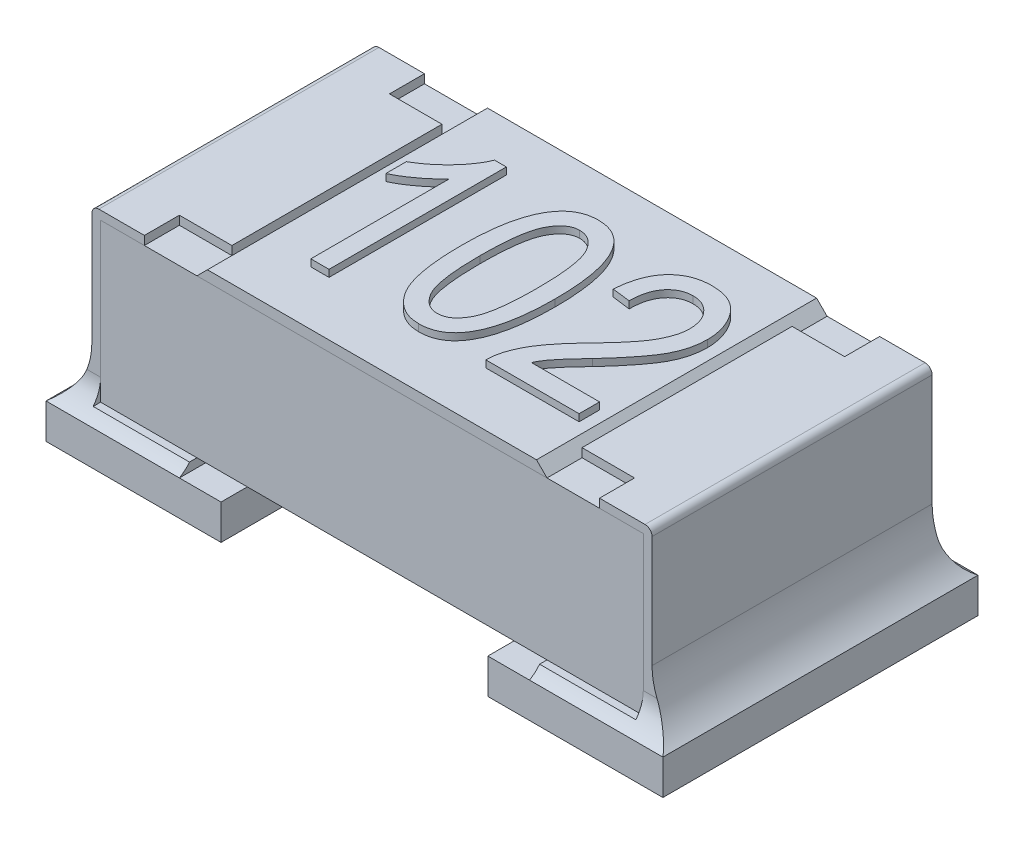
from build123d import *

# Parameters (mm, degrees)
SKETCH1_W             = 0.8
SKETCH1_H             = 0.45
BOSS_EXTRUDE1_DEPTH   = 0.775
BOSS_EXTRUDE2_DEPTH   = 0.4
BOSS_EXTRUDE2_2_DEPTH = 0.4
SKETCH3_W             = 0.15
SKETCH3_H             = 0.1
CUT_EXTRUDE1_DEPTH    = 0.025
BOSS_EXTRUDE3_DEPTH   = 0.4
SKETCH7_W             = 0.5
SKETCH7_H             = 0.9
BOSS_EXTRUDE5_DEPTH   = 0.1
FILLET3_R             = 0.2
FILLET4_R             = 0.2
FILLET5_R             = 0.1
FILLET6_R             = 0.1
BOSS_EXTRU_1_DEPTH    = 0.02


with BuildPart() as part:
    # Sketch1 → Boss-Extrude1 (new, symmetric)
    with BuildSketch(Plane(origin=(0, 0, 0), x_dir=(0, 0, -1), z_dir=(1, 0, 0))):
        with Locations((0, 0.35)):
            Rectangle(SKETCH1_W, SKETCH1_H)
    extrude(amount=BOSS_EXTRUDE1_DEPTH, both=True)


with BuildPart() as body_2:
    # Sketch2 → Boss-Extrude2 (new, symmetric)
    with BuildSketch(Plane.XY):
        with BuildLine():
            Line((-0.5, 0.6), (-0.78, 0.6))
            ThreePointArc((-0.78, 0.6), (-0.794142136, 0.594142136), (-0.8, 0.58))
            Line((-0.8, 0.58), (-0.8, 0.1))
            Line((-0.8, 0.1), (-0.5, 0.1))
            Line((-0.5, 0.1), (-0.5, 0.125))
            Line((-0.5, 0.125), (-0.775, 0.125))
            Line((-0.775, 0.125), (-0.775, 0.575))
            Line((-0.775, 0.575), (-0.5, 0.575))
            Line((-0.5, 0.575), (-0.5, 0.6))
        make_face()
    extrude(amount=BOSS_EXTRUDE2_DEPTH, both=True)


with BuildPart() as body_3:
    # Sketch2 → Boss-Extrude2 2 (new, symmetric)
    with BuildSketch(Plane.XY):
        with BuildLine():
            Line((0.5, 0.575), (0.5, 0.6))
            Line((0.5, 0.6), (0.78, 0.6))
            ThreePointArc((0.78, 0.6), (0.794142136, 0.594142136), (0.8, 0.58))
            Line((0.8, 0.58), (0.8, 0.1))
            Line((0.8, 0.1), (0.5, 0.1))
            Line((0.5, 0.1), (0.5, 0.125))
            Line((0.5, 0.125), (0.775, 0.125))
            Line((0.775, 0.125), (0.775, 0.575))
            Line((0.775, 0.575), (0.5, 0.575))
        make_face()
    extrude(amount=BOSS_EXTRUDE2_2_DEPTH, both=True)


with BuildPart() as cut_extrude1_tool:
    # Sketch3 → Cut-Extrude1 (new body)
    with BuildSketch(Plane(origin=(0, 0.6, 0), x_dir=(1, 0, 0), z_dir=(0, 1, 0))):
        with Locations((-0.575, 0.35)):
            Rectangle(SKETCH3_W, SKETCH3_H)
        with Locations((-0.575, -0.35)):
            Rectangle(SKETCH3_W, SKETCH3_H)
        with Locations((0.575, -0.35)):
            Rectangle(SKETCH3_W, SKETCH3_H)
        with Locations((0.575, 0.35)):
            Rectangle(SKETCH3_W, SKETCH3_H)
    extrude(amount=-CUT_EXTRUDE1_DEPTH)


with BuildPart() as body_2_1:
    add(body_2.part)

    # Cut-Extrude1: cut by cut_extrude1_tool
    add(cut_extrude1_tool.part, mode=Mode.SUBTRACT)



with BuildPart() as body_3_1:
    add(body_3.part)

    # Cut-Extrude1: cut by cut_extrude1_tool
    add(cut_extrude1_tool.part, mode=Mode.SUBTRACT)


with BuildPart() as body_4:
    # Sketch4 → Boss-Extrude3 (new, symmetric)
    with BuildSketch(Plane.XY):
        Polygon((-0.5, 0.575), (0.5, 0.575), (0.47, 0.605), (-0.47, 0.605), align=None)
    extrude(amount=BOSS_EXTRUDE3_DEPTH, both=True)

    # Esquisse2 → Boss.-Extru.1 (add)
    # profile 1 of 3: a face of its own
    with BuildSketch(Plane(origin=(0, 0.605, 0), x_dir=(1, 0, 0), z_dir=(0, 1, 0))):
        with BuildLine():
            Line((-0.277419159, -0.245221888), (-0.329367211, -0.245221888))
            Line((-0.329367211, -0.245221888), (-0.329367211, 0.150882009))
            add(Edge.make_bspline(
                [(-0.329367211, 0.150882009), (-0.33255753, 0.147209677), (-0.339169464, 0.139598774), (-0.350647442, 0.128775009), (-0.363438381, 0.1176135), (-0.377599648, 0.106782892), (-0.392028853, 0.096408923), (-0.406280373, 0.087284837), (-0.41982007, 0.079346193), (-0.428903295, 0.075031174), (-0.433263315, 0.072959931)],
                knots=[0, 0, 0, 0, 0.892555828, 1.849821039, 2.893015883, 4.008277588, 5.121255548, 6.154629642, 7.114207698, 8, 8, 8, 8], degree=3))
            Line((-0.433263315, 0.072959931), (-0.433263315, 0.131401489))
            add(Edge.make_bspline(
                [(-0.433263315, 0.131401489), (-0.426256411, 0.13561851), (-0.412302603, 0.144016443), (-0.392751491, 0.158564375), (-0.374281809, 0.174266475), (-0.35744561, 0.191287267), (-0.342370643, 0.208833156), (-0.329431452, 0.226343975), (-0.318822135, 0.243633673), (-0.313617925, 0.255526991), (-0.311104224, 0.261271619)],
                knots=[0, 0, 0, 0, 1.082272232, 2.155277244, 3.222407096, 4.289527553, 5.32168536, 6.282742408, 7.170542132, 8, 8, 8, 8], degree=3))
            Line((-0.311104224, 0.261271619), (-0.277419159, 0.261271619))
            Line((-0.277419159, 0.261271619), (-0.277419159, -0.245221888))
        make_face()
    # profile 2 of 3: a face of its own
    with BuildSketch(Plane(origin=(0, 0.605, 0), x_dir=(1, 0, 0), z_dir=(0, 1, 0))):
        with BuildLine():
            add(Edge.make_bspline(
                [(-0.147549029, 0.00457519), (-0.147466537, 0.01479126), (-0.147306358, 0.034628409), (-0.145650941, 0.063399949), (-0.143039858, 0.090278959), (-0.139489137, 0.115229398), (-0.134683655, 0.138255011), (-0.12902472, 0.15939274), (-0.122074419, 0.178575365), (-0.114251427, 0.195885139), (-0.105280253, 0.21122541), (-0.095389914, 0.224648892), (-0.084287025, 0.235937722), (-0.072277736, 0.245324824), (-0.059123137, 0.252476152), (-0.04501046, 0.257615666), (-0.029887534, 0.260717058), (-0.019452187, 0.261084261), (-0.014127763, 0.261271619)],
                knots=[0, 0, 0, 0, 1.522295809, 2.955932353, 4.292935845, 5.545987552, 6.709403679, 7.796379217, 8.803980711, 9.746667296, 10.623167879, 11.447716403, 12.224665142, 12.975696349, 13.710987297, 14.4460191, 15.207112772, 16, 16, 16, 16], degree=3))
            add(Edge.make_bspline(
                [(-0.014127763, 0.261271619), (-0.00938285, 0.261119405), (-6.4928e-05, 0.260820492), (0.013532278, 0.258355488), (0.026321328, 0.254161939), (0.038311883, 0.248334155), (0.04946752, 0.240809961), (0.059897997, 0.231712272), (0.069489012, 0.22085766), (0.075042737, 0.212703293), (0.0778974, 0.208511879)],
                knots=[0, 0, 0, 0, 1.02435884, 2.0116063, 2.972586715, 3.92329494, 4.881606269, 5.870473939, 6.905405214, 8, 8, 8, 8], degree=3))
            add(Edge.make_bspline(
                [(0.0778974, 0.208511879), (0.081201753, 0.202860902), (0.088073505, 0.191109101), (0.09627871, 0.171419216), (0.103194942, 0.149427268), (0.109026426, 0.125063264), (0.113186158, 0.098276968), (0.116478331, 0.069172575), (0.118383679, 0.037676929), (0.118581978, 0.015873733), (0.118684737, 0.00457519)],
                knots=[0, 0, 0, 0, 0.745747152, 1.550859881, 2.42529298, 3.372802996, 4.404287875, 5.514077945, 6.711780846, 8, 8, 8, 8], degree=3))
            add(Edge.make_bspline(
                [(0.118684737, 0.00457519), (0.118603246, -0.005573368), (0.118445039, -0.025275587), (0.116773055, -0.053910105), (0.114196761, -0.080658499), (0.110597814, -0.10553284), (0.105836898, -0.128501924), (0.100102772, -0.149633905), (0.093369381, -0.168919426), (0.085438101, -0.186231046), (0.076598991, -0.201660817), (0.066540873, -0.214948272), (0.055705564, -0.226438872), (0.043540388, -0.23562265), (0.030475546, -0.242976397), (0.016267757, -0.248029288), (0.001094421, -0.251174149), (-0.009377101, -0.25153216), (-0.014736529, -0.251715394)],
                knots=[0, 0, 0, 0, 1.513874866, 2.939007974, 4.277477108, 5.521918538, 6.686610019, 7.774777114, 8.786532326, 9.730252297, 10.61206932, 11.433487149, 12.211385775, 12.960169701, 13.698700869, 14.439280195, 15.201208188, 16, 16, 16, 16], degree=3))
            add(Edge.make_bspline(
                [(-0.014736529, -0.251715394), (-0.019516724, -0.251535975), (-0.028915126, -0.251183218), (-0.042705055, -0.248501144), (-0.05575647, -0.243876751), (-0.068138313, -0.237523555), (-0.079867046, -0.229401051), (-0.090799365, -0.219338145), (-0.101199397, -0.207599728), (-0.110942062, -0.19396939), (-0.119746041, -0.178096762), (-0.127188231, -0.159604049), (-0.133528749, -0.138579583), (-0.138560256, -0.114938484), (-0.142795274, -0.08877738), (-0.145456819, -0.059965056), (-0.147220924, -0.028557109), (-0.147436804, -0.006757381), (-0.147549029, 0.00457519)],
                knots=[0, 0, 0, 0, 0.713782411, 1.403376538, 2.088831486, 2.775699897, 3.476400496, 4.213162367, 4.989742879, 5.815463779, 6.710980744, 7.6941898, 8.787315853, 9.987366569, 11.302150399, 12.743876293, 14.307306722, 16, 16, 16, 16], degree=3))
        make_face()
        with BuildLine():
            add(Edge.make_bspline(
                [(-0.095600977, 0.004778112), (-0.095510395, -0.004962844), (-0.095337358, -0.023570963), (-0.094386416, -0.050273881), (-0.092589043, -0.074440086), (-0.090092676, -0.096145725), (-0.086927693, -0.115301137), (-0.083021376, -0.132011786), (-0.078366616, -0.146209724), (-0.072890289, -0.158097103), (-0.066817423, -0.167965156), (-0.060330818, -0.176373903), (-0.053623871, -0.183666527), (-0.046292266, -0.189491854), (-0.038680682, -0.194202042), (-0.030494994, -0.19727545), (-0.022023943, -0.199493814), (-0.016171753, -0.199675523), (-0.013214613, -0.199767342)],
                knots=[0, 0, 0, 0, 1.930873368, 3.688541263, 5.295281011, 6.732986767, 8.018032389, 9.141589856, 10.131594649, 10.974379403, 11.729767228, 12.422984227, 13.077418253, 13.687793181, 14.274134012, 14.843047171, 15.415386244, 16, 16, 16, 16], degree=3))
            add(Edge.make_bspline(
                [(-0.013214613, -0.199767342), (-0.010427064, -0.19967107), (-0.004876608, -0.199479377), (0.003214206, -0.197283662), (0.011014124, -0.194062792), (0.018392056, -0.189401372), (0.025337409, -0.183405877), (0.031944313, -0.176126804), (0.038222607, -0.167556151), (0.044243115, -0.157540122), (0.049661257, -0.145592351), (0.054269802, -0.131326946), (0.058147641, -0.114621658), (0.061355308, -0.095476215), (0.063679163, -0.073856395), (0.065539644, -0.049836144), (0.066465897, -0.023333722), (0.066643834, -0.004861208), (0.066736685, 0.004778112)],
                knots=[0, 0, 0, 0, 0.556098029, 1.107279675, 1.665020537, 2.239289732, 2.843790749, 3.494855459, 4.20099618, 4.965402842, 5.827994078, 6.818278647, 7.958442113, 9.254955883, 10.697998423, 12.305588537, 14.072183745, 16, 16, 16, 16], degree=3))
            add(Edge.make_bspline(
                [(0.066736685, 0.004778112), (0.066644247, 0.014518953), (0.066467022, 0.033194439), (0.065536544, 0.059932684), (0.063706558, 0.084163121), (0.061254358, 0.105841815), (0.058028708, 0.125018143), (0.054199757, 0.141717126), (0.049468888, 0.155886496), (0.044070333, 0.167750164), (0.037873861, 0.177530431), (0.031547138, 0.186066808), (0.024613966, 0.193179002), (0.017326453, 0.199101273), (0.009578464, 0.203716122), (0.001336, 0.207013805), (-0.007336855, 0.208998194), (-0.013272092, 0.209214654), (-0.016258444, 0.209323567)],
                knots=[0, 0, 0, 0, 1.926173374, 3.692928135, 5.28908838, 6.72993665, 8.005261178, 9.132588719, 10.113846285, 10.954579593, 11.702439438, 12.399284011, 13.051919516, 13.660808713, 14.251466784, 14.827675714, 15.41013748, 16, 16, 16, 16], degree=3))
            add(Edge.make_bspline(
                [(-0.016258444, 0.209323567), (-0.019046448, 0.209229838), (-0.024564948, 0.209044314), (-0.032588492, 0.206839344), (-0.040285896, 0.203615308), (-0.047609781, 0.198933153), (-0.054467733, 0.192853165), (-0.061128216, 0.185619176), (-0.067268818, 0.176971227), (-0.073311403, 0.16704689), (-0.078634531, 0.155067165), (-0.083250225, 0.140826575), (-0.086962575, 0.124091318), (-0.090243034, 0.105003485), (-0.092537193, 0.083411294), (-0.094405868, 0.059392779), (-0.095329633, 0.03288983), (-0.095507935, 0.014417392), (-0.095600977, 0.004778112)],
                knots=[0, 0, 0, 0, 0.557102101, 1.102712893, 1.655222221, 2.224793741, 2.834805151, 3.487045402, 4.190458401, 4.956245252, 5.811421647, 6.809929224, 7.950602775, 9.242777249, 10.688425301, 12.298918027, 14.068702942, 16, 16, 16, 16], degree=3))
        make_face(mode=Mode.SUBTRACT)
    # profile 3 of 3: a face of its own
    with BuildSketch(Plane(origin=(0, 0.605, 0), x_dir=(1, 0, 0), z_dir=(0, 1, 0))):
        with BuildLine():
            Line((0.436866556, -0.186780329), (0.436866556, -0.245221888))
            Line((0.436866556, -0.245221888), (0.170632789, -0.245221888))
            add(Edge.make_bspline(
                [(0.170632789, -0.245221888), (0.170620463, -0.242176838), (0.170595488, -0.236007517), (0.171425805, -0.226601844), (0.173131761, -0.216968453), (0.175310093, -0.206978835), (0.17839873, -0.196764374), (0.182179794, -0.186275439), (0.186641118, -0.175538143), (0.191864922, -0.164488895), (0.197969199, -0.153021711), (0.205335292, -0.141184566), (0.213800759, -0.128765128), (0.223376797, -0.115839112), (0.234250689, -0.102529104), (0.246099687, -0.088637518), (0.259092893, -0.074193289), (0.268344083, -0.064593521), (0.273108439, -0.059649647)],
                knots=[0, 0, 0, 0, 0.672188691, 1.361865275, 2.08134618, 2.831455259, 3.618325166, 4.435686407, 5.292818481, 6.184803937, 7.133719261, 8.159707436, 9.261705982, 10.452168352, 11.710682541, 13.056179633, 14.483934645, 16, 16, 16, 16], degree=3))
            add(Edge.make_bspline(
                [(0.273108439, -0.059649647), (0.278645154, -0.053922862), (0.28930567, -0.042896383), (0.304309328, -0.026615111), (0.317941658, -0.011481871), (0.329930295, 0.002776991), (0.340488081, 0.015967273), (0.349721239, 0.028070116), (0.357188517, 0.039360185), (0.365251054, 0.052644574), (0.372937537, 0.068459429), (0.379732824, 0.086894144), (0.384123449, 0.104715028), (0.384658645, 0.116463957), (0.384918504, 0.122168535)],
                knots=[0, 0, 0, 0, 1.312560889, 2.527233899, 3.64818266, 4.668586789, 5.596397896, 6.432357998, 7.175835261, 7.825761013, 8.992224112, 10.065918602, 11.060925749, 12, 12, 12, 12], degree=3))
            add(Edge.make_bspline(
                [(0.384918504, 0.122168535), (0.38488227, 0.125317915), (0.384811501, 0.131468985), (0.383608892, 0.140451965), (0.381893813, 0.14899617), (0.3796294, 0.157163351), (0.376418723, 0.164819361), (0.372571791, 0.172017316), (0.368065657, 0.178789817), (0.362923472, 0.185037408), (0.357252813, 0.190673516), (0.351276734, 0.195736851), (0.344839772, 0.199834879), (0.338206488, 0.203402296), (0.33115273, 0.205987741), (0.323827032, 0.207958519), (0.316161618, 0.209069733), (0.310956748, 0.209238117), (0.308315419, 0.209323567)],
                knots=[0, 0, 0, 0, 1.164486654, 2.274364258, 3.346924328, 4.388668322, 5.404300818, 6.412115579, 7.404820287, 8.409522099, 9.400647826, 10.360464378, 11.301161788, 12.219192522, 13.141987859, 14.073903283, 15.022558797, 16, 16, 16, 16], degree=3))
            add(Edge.make_bspline(
                [(0.308315419, 0.209323567), (0.305467549, 0.209263822), (0.299908376, 0.209147197), (0.291805518, 0.207697867), (0.284041492, 0.205758951), (0.276655696, 0.202751859), (0.269702154, 0.198899959), (0.263080695, 0.194263463), (0.256920928, 0.188754733), (0.251098767, 0.182490648), (0.245994902, 0.175347606), (0.241308805, 0.167618053), (0.237618701, 0.158974566), (0.234481048, 0.149683668), (0.232023772, 0.139637057), (0.230381279, 0.128872622), (0.229176758, 0.117392989), (0.229109112, 0.109489326), (0.229074348, 0.105427463)],
                knots=[0, 0, 0, 0, 0.928788257, 1.813037313, 2.680996359, 3.53827917, 4.408273621, 5.272359245, 6.172129225, 7.102295458, 8.058839945, 9.034325244, 10.048074492, 11.120300332, 12.234644845, 13.420320921, 14.674247329, 16, 16, 16, 16], degree=3))
            Line((0.229074348, 0.105427463), (0.177126296, 0.11192097))
            add(Edge.make_bspline(
                [(0.177126296, 0.11192097), (0.177661646, 0.117949128), (0.178700249, 0.129644029), (0.181425255, 0.146574214), (0.185206691, 0.162282392), (0.189695492, 0.176925272), (0.195342921, 0.190321129), (0.201656925, 0.202713751), (0.209140532, 0.213833745), (0.217485989, 0.223818585), (0.226623406, 0.232677174), (0.236501282, 0.24032371), (0.247106206, 0.246769595), (0.258317066, 0.252189545), (0.270365598, 0.256236922), (0.283035651, 0.259174418), (0.296430274, 0.260914731), (0.305570867, 0.261150899), (0.310243179, 0.261271619)],
                knots=[0, 0, 0, 0, 1.296155121, 2.514599762, 3.669097984, 4.755193195, 5.79120272, 6.77953026, 7.729955905, 8.65570694, 9.562583864, 10.450894749, 11.325630111, 12.216772649, 13.112585423, 14.04224033, 14.999270054, 16, 16, 16, 16], degree=3))
            add(Edge.make_bspline(
                [(0.310243179, 0.261271619), (0.315287924, 0.261123536), (0.325110881, 0.260835194), (0.339410791, 0.258935248), (0.352748071, 0.255583871), (0.365182294, 0.250920378), (0.376564128, 0.244781019), (0.387078711, 0.237416689), (0.396550564, 0.228603521), (0.404979649, 0.21857538), (0.412428841, 0.207748797), (0.418928747, 0.196427916), (0.424566895, 0.18480032), (0.428973266, 0.172736626), (0.432653055, 0.16039874), (0.434964779, 0.147599635), (0.436592216, 0.134486989), (0.436774592, 0.125623379), (0.436866556, 0.121153924)],
                knots=[0, 0, 0, 0, 1.141256367, 2.222215694, 3.255808886, 4.246221905, 5.218350639, 6.173592628, 7.142736081, 8.136099926, 9.131465336, 10.11177911, 11.087094076, 12.050634184, 13.014356534, 13.995714735, 14.989343724, 16, 16, 16, 16], degree=3))
            add(Edge.make_bspline(
                [(0.436866556, 0.121153924), (0.436779909, 0.117127141), (0.436607744, 0.109126037), (0.4354878, 0.097187936), (0.43351089, 0.085410333), (0.43094396, 0.073679984), (0.427301469, 0.062178516), (0.423177974, 0.050723257), (0.418176495, 0.039443439), (0.412272125, 0.028118881), (0.405358874, 0.016348836), (0.397074513, 0.003918486), (0.387572676, -0.009504436), (0.376467413, -0.023680764), (0.364296829, -0.039018169), (0.350523248, -0.055130192), (0.335415402, -0.072158915), (0.324771484, -0.083713449), (0.319273211, -0.089682115)],
                knots=[0, 0, 0, 0, 0.78053567, 1.550902233, 2.321464013, 3.094364546, 3.87611052, 4.657966429, 5.453363508, 6.265521698, 7.132350641, 8.097801917, 9.160103787, 10.319208993, 11.587678713, 12.955014444, 14.427067756, 16, 16, 16, 16], degree=3))
            add(Edge.make_bspline(
                [(0.319273211, -0.089682115), (0.31578272, -0.093395828), (0.30911211, -0.100493032), (0.299665728, -0.110762774), (0.291188926, -0.120105032), (0.28349715, -0.128388282), (0.276970664, -0.135891091), (0.271312279, -0.142415262), (0.266688943, -0.148041211), (0.259760015, -0.156885556), (0.251020841, -0.169347157), (0.244983139, -0.181095194), (0.242061361, -0.186780329)],
                knots=[0, 0, 0, 0, 1.227496676, 2.345844757, 3.360613726, 4.265798447, 5.068085109, 5.75545707, 6.345771879, 6.821573405, 8.46188917, 10, 10, 10, 10], degree=3))
            Line((0.242061361, -0.186780329), (0.436866556, -0.186780329))
        make_face()
    extrude(amount=BOSS_EXTRU_1_DEPTH)


with BuildPart() as body_2_2:
    add(body_2_1.part)

    add(body_3_1.part)  # Boss-Extrude5 merges body 3
    # Sketch7 → Boss-Extrude5 (add)
    with BuildSketch(Plane(origin=(0, 0, 0), x_dir=(1, 0, 0), z_dir=(0, 1, 0))):
        with Locations((-0.631, 0)):
            Rectangle(SKETCH7_W, SKETCH7_H)
        with Locations((0.631, 0)):
            Rectangle(SKETCH7_W, SKETCH7_H)
    extrude(amount=BOSS_EXTRUDE5_DEPTH)

    # Fillet3
    # the kernel refuses this fillet: 0.2 mm, written as the material it adds along each edge
    with BuildSketch(Plane(origin=(-0.8, 0.1, -0.4), x_dir=(-1.0, 1.981473969784949e-11, 0), z_dir=(0, 0, 1))) as fillet3_piece_1:
        with BuildLine():
            CenterArc((0.2, -0.16074514), FILLET3_R, 126.5126321, 53.487367901)
            Line((0, -0.16074514), (-0.004, -0.16074514))
            Line((-0.004, -0.16074514), (-0.004, 0))
            Line((-0.004, 0), (0, 0.004))
            ThreePointArc((0, 0.004), (0.0405, 0.004), (0.07862, 0.003214903))
            Line((0.07862, 0.003214903), (0.081, 0))
        make_face()
    extrude(amount=0.8)

    # Fillet4
    # the kernel refuses this fillet: 0.2 mm, written as the material it adds along each edge
    with BuildSketch(Plane(origin=(0.8, 0.1, 0.4), x_dir=(1.0, 1.981542502070424e-11, 0), z_dir=(0, 0, -1))) as fillet4_piece_1:
        with BuildLine():
            CenterArc((0.2, -0.16074514), FILLET4_R, 126.5126321, 53.487367901)
            Line((0, -0.16074514), (-0.004, -0.16074514))
            Line((-0.004, -0.16074514), (-0.004, 0))
            Line((-0.004, 0), (0, 0.004))
            ThreePointArc((0, 0.004), (0.0405, 0.004), (0.07862, 0.003214903))
            Line((0.07862, 0.003214903), (0.081, 0))
        make_face()
    extrude(amount=0.8)

    # Fillet5
    # the kernel refuses this fillet: 0.1 mm, written as the material it adds along each edge
    with BuildSketch(Plane(origin=(0.5, 0.1, 0.4), x_dir=(0, -1.6392998070069752e-11, 1.0), z_dir=(1.0, 4.321346430286522e-12, 0))) as fillet5_piece_1_section:
        with BuildLine():
            CenterArc((0.1, -0.08660254), FILLET5_R, 119.999999999, 60)
            Line((0, -0.08660254), (-0.002, -0.08660254))
            Line((-0.002, -0.08660254), (-0.002, 0))
            Line((-0.002, 0), (0, 0.002))
            ThreePointArc((0, 0.002), (0.025, 0.002), (0.049, 0.001732051))
            Line((0.049, 0.001732051), (0.05, 0))
        make_face()
    fillet5_piece_1 = extrude(amount=0.381, mode=Mode.PRIVATE)
    fillet5_piece_1 = split(fillet5_piece_1, bisect_by=Plane(origin=(0.5, 0.125, 0.4), z_dir=(0, -1, 0)), keep=Keep.TOP, mode=Mode.PRIVATE)
    fillet5_piece_1 = split(fillet5_piece_1, bisect_by=Plane(origin=(0.775, 0.1, 0.4), z_dir=(-1, 0, 0)), keep=Keep.TOP, mode=Mode.PRIVATE)
    add(fillet5_piece_1)
    with BuildSketch(Plane(origin=(0.5, 0.1, 0.4), x_dir=(0, -1.6392998070069752e-11, 1.0), z_dir=(1.0, 4.321346430286522e-12, 0))) as fillet5_piece_2_section:
        with BuildLine():
            CenterArc((0.1, -0.08660254), FILLET5_R, 119.999999999, 60)
            Line((0, -0.08660254), (-0.002, -0.08660254))
            Line((-0.002, -0.08660254), (-0.002, 0))
            Line((-0.002, 0), (0, 0.002))
            ThreePointArc((0, 0.002), (0.025, 0.002), (0.049, 0.001732051))
            Line((0.049, 0.001732051), (0.05, 0))
        make_face()
    fillet5_piece_2 = extrude(amount=0.381, mode=Mode.PRIVATE)
    fillet5_piece_2 = fillet5_piece_2 - Plane(origin=(1, 0.26074514, 0.4), x_dir=(1.0, 2e-11, 0), z_dir=(0, 0, 1)) * Cylinder(0.2, 2, mode=Mode.PRIVATE)
    fillet5_piece_2 = split(fillet5_piece_2, bisect_by=Plane(origin=(0.5, 0.125, 0.4), z_dir=(0, -1, 0)), keep=Keep.TOP, mode=Mode.PRIVATE)
    fillet5_piece_2 = split(fillet5_piece_2, bisect_by=Plane(origin=(0.775, 0.1, 0.4), z_dir=(1, 0, 0)), keep=Keep.TOP, mode=Mode.PRIVATE)
    add(fillet5_piece_2)
    with BuildSketch(Plane(origin=(0.5, 0.1, 0.4), x_dir=(0, -1.6392998070069752e-11, 1.0), z_dir=(1.0, 4.321346430286522e-12, 0))) as fillet5_piece_3_section:
        with BuildLine():
            CenterArc((0.1, -0.08660254), FILLET5_R, 119.999999999, 60)
            Line((0, -0.08660254), (-0.002, -0.08660254))
            Line((-0.002, -0.08660254), (-0.002, 0))
            Line((-0.002, 0), (0, 0.002))
            ThreePointArc((0, 0.002), (0.025, 0.002), (0.049, 0.001732051))
            Line((0.049, 0.001732051), (0.05, 0))
        make_face()
    fillet5_piece_3 = extrude(amount=0.381, mode=Mode.PRIVATE)
    fillet5_piece_3 = fillet5_piece_3 - Plane(origin=(1, 0.26074514, 0.4), x_dir=(1.0, 2e-11, 0), z_dir=(0, 0, 1)) * Cylinder(0.2, 2, mode=Mode.PRIVATE)
    fillet5_piece_3 = split(fillet5_piece_3, bisect_by=Plane(origin=(0.5, 0.125, 0.4), z_dir=(0, 1, 0)), keep=Keep.TOP, mode=Mode.PRIVATE)
    fillet5_piece_3 = split(fillet5_piece_3, bisect_by=Plane(origin=(0.775, 0.1, 0.4), z_dir=(1, 0, 0)), keep=Keep.TOP, mode=Mode.PRIVATE)
    add(fillet5_piece_3)
    # the kernel refuses this fillet: 0.1 mm, written as the material it adds along each edge
    with BuildSketch(Plane(origin=(0.881, 0.1, -0.4), x_dir=(0, -1.639244295855736e-11, -1.0), z_dir=(-1.0, -4.321346430286522e-12, 0))) as fillet5_2_piece_1_section:
        with BuildLine():
            CenterArc((0.1, -0.08660254), FILLET5_R, 119.999999999, 60)
            Line((0, -0.08660254), (-0.002, -0.08660254))
            Line((-0.002, -0.08660254), (-0.002, 0))
            Line((-0.002, 0), (0, 0.002))
            ThreePointArc((0, 0.002), (0.025, 0.002), (0.049, 0.001732051))
            Line((0.049, 0.001732051), (0.05, 0))
        make_face()
    fillet5_2_piece_1 = extrude(amount=0.381, mode=Mode.PRIVATE)
    fillet5_2_piece_1 = fillet5_2_piece_1 - Plane(origin=(1, 0.26074514, -0.4), x_dir=(1.0, 2e-11, 0), z_dir=(0, 0, 1)) * Cylinder(0.2, 2, mode=Mode.PRIVATE)
    fillet5_2_piece_1 = split(fillet5_2_piece_1, bisect_by=Plane(origin=(0.881, 0.125, -0.4), z_dir=(0, -1, 0)), keep=Keep.TOP, mode=Mode.PRIVATE)
    fillet5_2_piece_1 = split(fillet5_2_piece_1, bisect_by=Plane(origin=(0.775, 0.1, -0.4), z_dir=(1, 0, 0)), keep=Keep.TOP, mode=Mode.PRIVATE)
    add(fillet5_2_piece_1)
    with BuildSketch(Plane(origin=(0.881, 0.1, -0.4), x_dir=(0, -1.639244295855736e-11, -1.0), z_dir=(-1.0, -4.321346430286522e-12, 0))) as fillet5_2_piece_2_section:
        with BuildLine():
            CenterArc((0.1, -0.08660254), FILLET5_R, 119.999999999, 60)
            Line((0, -0.08660254), (-0.002, -0.08660254))
            Line((-0.002, -0.08660254), (-0.002, 0))
            Line((-0.002, 0), (0, 0.002))
            ThreePointArc((0, 0.002), (0.025, 0.002), (0.049, 0.001732051))
            Line((0.049, 0.001732051), (0.05, 0))
        make_face()
    fillet5_2_piece_2 = extrude(amount=0.381, mode=Mode.PRIVATE)
    fillet5_2_piece_2 = fillet5_2_piece_2 - Plane(origin=(1, 0.26074514, -0.4), x_dir=(1.0, 2e-11, 0), z_dir=(0, 0, 1)) * Cylinder(0.2, 2, mode=Mode.PRIVATE)
    fillet5_2_piece_2 = split(fillet5_2_piece_2, bisect_by=Plane(origin=(0.881, 0.125, -0.4), z_dir=(0, 1, 0)), keep=Keep.TOP, mode=Mode.PRIVATE)
    fillet5_2_piece_2 = split(fillet5_2_piece_2, bisect_by=Plane(origin=(0.775, 0.1, -0.4), z_dir=(1, 0, 0)), keep=Keep.TOP, mode=Mode.PRIVATE)
    add(fillet5_2_piece_2)
    with BuildSketch(Plane(origin=(0.881, 0.1, -0.4), x_dir=(0, -1.639244295855736e-11, -1.0), z_dir=(-1.0, -4.321346430286522e-12, 0))) as fillet5_2_piece_3_section:
        with BuildLine():
            CenterArc((0.1, -0.08660254), FILLET5_R, 119.999999999, 60)
            Line((0, -0.08660254), (-0.002, -0.08660254))
            Line((-0.002, -0.08660254), (-0.002, 0))
            Line((-0.002, 0), (0, 0.002))
            ThreePointArc((0, 0.002), (0.025, 0.002), (0.049, 0.001732051))
            Line((0.049, 0.001732051), (0.05, 0))
        make_face()
    fillet5_2_piece_3 = extrude(amount=0.381, mode=Mode.PRIVATE)
    fillet5_2_piece_3 = split(fillet5_2_piece_3, bisect_by=Plane(origin=(0.881, 0.125, -0.4), z_dir=(0, -1, 0)), keep=Keep.TOP, mode=Mode.PRIVATE)
    fillet5_2_piece_3 = split(fillet5_2_piece_3, bisect_by=Plane(origin=(0.775, 0.1, -0.4), z_dir=(-1, 0, 0)), keep=Keep.TOP, mode=Mode.PRIVATE)
    add(fillet5_2_piece_3)

    # Fillet6
    # the kernel refuses this fillet: 0.1 mm, written as the material it adds along each edge
    with BuildSketch(Plane(origin=(-0.5, 0.1, -0.4), x_dir=(0, -1.6393275625825854e-11, -1.0), z_dir=(-1.0, 4.321237156366773e-12, 0))) as fillet6_piece_1_section:
        with BuildLine():
            CenterArc((0.1, -0.08660254), FILLET6_R, 119.999999999, 60)
            Line((0, -0.08660254), (-0.002, -0.08660254))
            Line((-0.002, -0.08660254), (-0.002, 0))
            Line((-0.002, 0), (0, 0.002))
            ThreePointArc((0, 0.002), (0.025, 0.002), (0.049, 0.001732051))
            Line((0.049, 0.001732051), (0.05, 0))
        make_face()
    fillet6_piece_1 = extrude(amount=0.381, mode=Mode.PRIVATE)
    fillet6_piece_1 = split(fillet6_piece_1, bisect_by=Plane(origin=(-0.5, 0.125, -0.4), z_dir=(0, -1, 0)), keep=Keep.TOP, mode=Mode.PRIVATE)
    fillet6_piece_1 = split(fillet6_piece_1, bisect_by=Plane(origin=(-0.775, 0.1, -0.4), z_dir=(1, 0, 0)), keep=Keep.TOP, mode=Mode.PRIVATE)
    add(fillet6_piece_1)
    with BuildSketch(Plane(origin=(-0.5, 0.1, -0.4), x_dir=(0, -1.6393275625825854e-11, -1.0), z_dir=(-1.0, 4.321237156366773e-12, 0))) as fillet6_piece_2_section:
        with BuildLine():
            CenterArc((0.1, -0.08660254), FILLET6_R, 119.999999999, 60)
            Line((0, -0.08660254), (-0.002, -0.08660254))
            Line((-0.002, -0.08660254), (-0.002, 0))
            Line((-0.002, 0), (0, 0.002))
            ThreePointArc((0, 0.002), (0.025, 0.002), (0.049, 0.001732051))
            Line((0.049, 0.001732051), (0.05, 0))
        make_face()
    fillet6_piece_2 = extrude(amount=0.381, mode=Mode.PRIVATE)
    fillet6_piece_2 = fillet6_piece_2 - Plane(origin=(-1, 0.26074514, -0.4), x_dir=(-1.0, 2e-11, 0), z_dir=(0, 0, -1)) * Cylinder(0.2, 2, mode=Mode.PRIVATE)
    fillet6_piece_2 = split(fillet6_piece_2, bisect_by=Plane(origin=(-0.5, 0.125, -0.4), z_dir=(0, -1, 0)), keep=Keep.TOP, mode=Mode.PRIVATE)
    fillet6_piece_2 = split(fillet6_piece_2, bisect_by=Plane(origin=(-0.775, 0.1, -0.4), z_dir=(-1, 0, 0)), keep=Keep.TOP, mode=Mode.PRIVATE)
    add(fillet6_piece_2)
    with BuildSketch(Plane(origin=(-0.5, 0.1, -0.4), x_dir=(0, -1.6393275625825854e-11, -1.0), z_dir=(-1.0, 4.321237156366773e-12, 0))) as fillet6_piece_3_section:
        with BuildLine():
            CenterArc((0.1, -0.08660254), FILLET6_R, 119.999999999, 60)
            Line((0, -0.08660254), (-0.002, -0.08660254))
            Line((-0.002, -0.08660254), (-0.002, 0))
            Line((-0.002, 0), (0, 0.002))
            ThreePointArc((0, 0.002), (0.025, 0.002), (0.049, 0.001732051))
            Line((0.049, 0.001732051), (0.05, 0))
        make_face()
    fillet6_piece_3 = extrude(amount=0.381, mode=Mode.PRIVATE)
    fillet6_piece_3 = fillet6_piece_3 - Plane(origin=(-1, 0.26074514, -0.4), x_dir=(-1.0, 2e-11, 0), z_dir=(0, 0, -1)) * Cylinder(0.2, 2, mode=Mode.PRIVATE)
    fillet6_piece_3 = split(fillet6_piece_3, bisect_by=Plane(origin=(-0.5, 0.125, -0.4), z_dir=(0, 1, 0)), keep=Keep.TOP, mode=Mode.PRIVATE)
    fillet6_piece_3 = split(fillet6_piece_3, bisect_by=Plane(origin=(-0.775, 0.1, -0.4), z_dir=(-1, 0, 0)), keep=Keep.TOP, mode=Mode.PRIVATE)
    add(fillet6_piece_3)
    # the kernel refuses this fillet: 0.1 mm, written as the material it adds along each edge
    with BuildSketch(Plane(origin=(-0.881, 0.1, 0.4), x_dir=(0, -1.6393830737338195e-11, 1.0), z_dir=(1.0, -4.321237156366773e-12, 0))) as fillet6_2_piece_1_section:
        with BuildLine():
            CenterArc((0.1, -0.08660254), FILLET6_R, 119.999999999, 60)
            Line((0, -0.08660254), (-0.002, -0.08660254))
            Line((-0.002, -0.08660254), (-0.002, 0))
            Line((-0.002, 0), (0, 0.002))
            ThreePointArc((0, 0.002), (0.025, 0.002), (0.049, 0.001732051))
            Line((0.049, 0.001732051), (0.05, 0))
        make_face()
    fillet6_2_piece_1 = extrude(amount=0.381, mode=Mode.PRIVATE)
    fillet6_2_piece_1 = fillet6_2_piece_1 - Plane(origin=(-1, 0.26074514, 0.4), x_dir=(-1.0, 2e-11, 0), z_dir=(0, 0, -1)) * Cylinder(0.2, 2, mode=Mode.PRIVATE)
    fillet6_2_piece_1 = split(fillet6_2_piece_1, bisect_by=Plane(origin=(-0.881, 0.125, 0.4), z_dir=(0, -1, 0)), keep=Keep.TOP, mode=Mode.PRIVATE)
    fillet6_2_piece_1 = split(fillet6_2_piece_1, bisect_by=Plane(origin=(-0.775, 0.1, 0.4), z_dir=(-1, 0, 0)), keep=Keep.TOP, mode=Mode.PRIVATE)
    add(fillet6_2_piece_1)
    with BuildSketch(Plane(origin=(-0.881, 0.1, 0.4), x_dir=(0, -1.6393830737338195e-11, 1.0), z_dir=(1.0, -4.321237156366773e-12, 0))) as fillet6_2_piece_2_section:
        with BuildLine():
            CenterArc((0.1, -0.08660254), FILLET6_R, 119.999999999, 60)
            Line((0, -0.08660254), (-0.002, -0.08660254))
            Line((-0.002, -0.08660254), (-0.002, 0))
            Line((-0.002, 0), (0, 0.002))
            ThreePointArc((0, 0.002), (0.025, 0.002), (0.049, 0.001732051))
            Line((0.049, 0.001732051), (0.05, 0))
        make_face()
    fillet6_2_piece_2 = extrude(amount=0.381, mode=Mode.PRIVATE)
    fillet6_2_piece_2 = fillet6_2_piece_2 - Plane(origin=(-1, 0.26074514, 0.4), x_dir=(-1.0, 2e-11, 0), z_dir=(0, 0, -1)) * Cylinder(0.2, 2, mode=Mode.PRIVATE)
    fillet6_2_piece_2 = split(fillet6_2_piece_2, bisect_by=Plane(origin=(-0.881, 0.125, 0.4), z_dir=(0, 1, 0)), keep=Keep.TOP, mode=Mode.PRIVATE)
    fillet6_2_piece_2 = split(fillet6_2_piece_2, bisect_by=Plane(origin=(-0.775, 0.1, 0.4), z_dir=(-1, 0, 0)), keep=Keep.TOP, mode=Mode.PRIVATE)
    add(fillet6_2_piece_2)
    with BuildSketch(Plane(origin=(-0.881, 0.1, 0.4), x_dir=(0, -1.6393830737338195e-11, 1.0), z_dir=(1.0, -4.321237156366773e-12, 0))) as fillet6_2_piece_3_section:
        with BuildLine():
            CenterArc((0.1, -0.08660254), FILLET6_R, 119.999999999, 60)
            Line((0, -0.08660254), (-0.002, -0.08660254))
            Line((-0.002, -0.08660254), (-0.002, 0))
            Line((-0.002, 0), (0, 0.002))
            ThreePointArc((0, 0.002), (0.025, 0.002), (0.049, 0.001732051))
            Line((0.049, 0.001732051), (0.05, 0))
        make_face()
    fillet6_2_piece_3 = extrude(amount=0.381, mode=Mode.PRIVATE)
    fillet6_2_piece_3 = split(fillet6_2_piece_3, bisect_by=Plane(origin=(-0.881, 0.125, 0.4), z_dir=(0, -1, 0)), keep=Keep.TOP, mode=Mode.PRIVATE)
    fillet6_2_piece_3 = split(fillet6_2_piece_3, bisect_by=Plane(origin=(-0.775, 0.1, 0.4), z_dir=(1, 0, 0)), keep=Keep.TOP, mode=Mode.PRIVATE)
    add(fillet6_2_piece_3)


solid = Compound([part.part, body_4.part, body_2_2.part])
